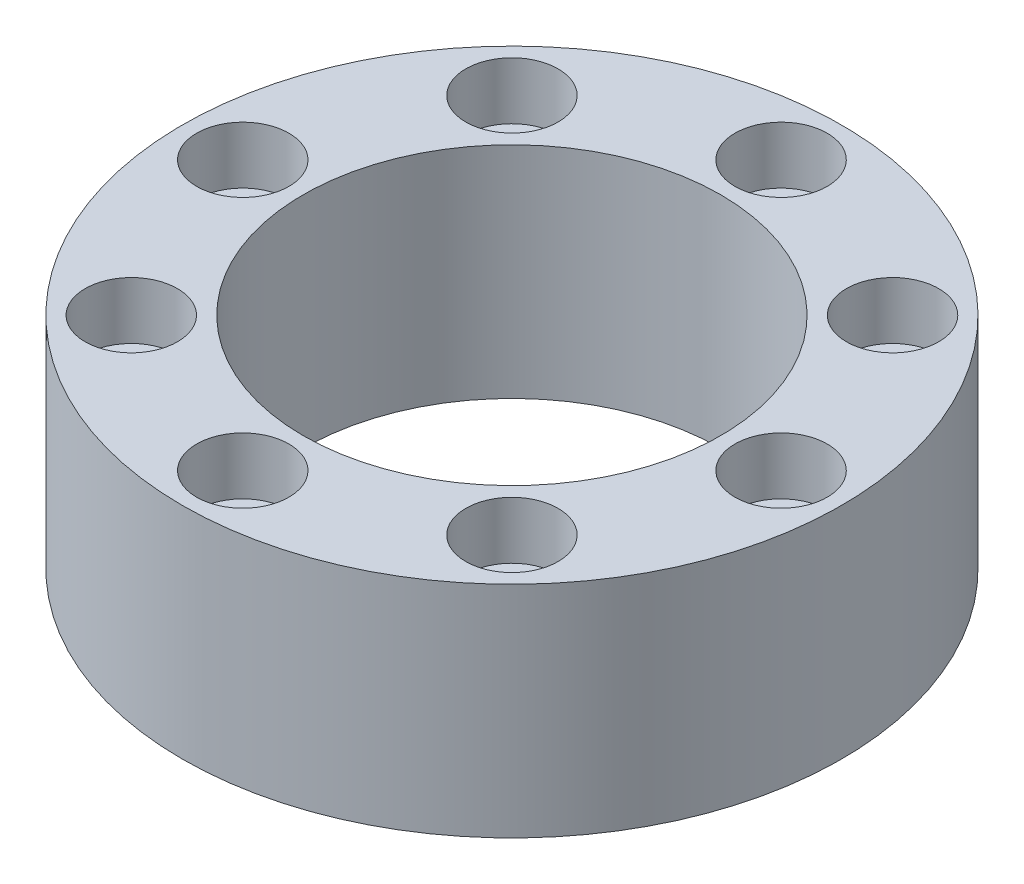
from build123d import *

# Parameters (mm, degrees)
ESQUISSE1_R             = 30
ESQUISSE1_R_2           = 19
BOSS_EXTRU_2_DEPTH      = 20
ESQUISSE5_R             = 2.55
ENL_V_MAT_EXTRU_3_DEPTH = 47.904157598
ESQUISSE6_R             = 4.2
ENL_V_MAT_EXTRU_4_DEPTH = 5.2


with BuildPart() as part:
    # Esquisse1 → Boss.-Extru.2 (new body)
    with BuildSketch(Plane(origin=(0, 0, 0), x_dir=(1, 0, 0), z_dir=(0, 1, 0))):
        Circle(ESQUISSE1_R)
        Circle(ESQUISSE1_R_2, mode=Mode.SUBTRACT)
    extrude(amount=BOSS_EXTRU_2_DEPTH)

    # Esquisse5 → Enlèv. mat.-Extru.3 (cut, through all)
    with BuildSketch(Plane(origin=(0, 20, 0), x_dir=(1, 0, 0), z_dir=(0, 1, 0))):
        with Locations((24.5, 0)):
            Circle(ESQUISSE5_R)
        with Locations((17.324116139, -17.324116139)):
            Circle(ESQUISSE5_R)
        with Locations((0, -24.5)):
            Circle(ESQUISSE5_R)
        with Locations((-17.324116139, -17.324116139)):
            Circle(ESQUISSE5_R)
        with Locations((-24.5, 0)):
            Circle(ESQUISSE5_R)
        with Locations((-17.324116139, 17.324116139)):
            Circle(ESQUISSE5_R)
        with Locations((0, 24.5)):
            Circle(ESQUISSE5_R)
        with Locations((17.324116139, 17.324116139)):
            Circle(ESQUISSE5_R)
    extrude(amount=-ENL_V_MAT_EXTRU_3_DEPTH, mode=Mode.SUBTRACT)

    # Esquisse6 → Enlèv. mat.-Extru.4 (cut)
    with BuildSketch(Plane(origin=(0, 20, 0), x_dir=(1, 0, 0), z_dir=(0, 1, 0))):
        with Locations((24.5, 0)):
            Circle(ESQUISSE6_R)
        with Locations((17.324116139, 17.324116139)):
            Circle(ESQUISSE6_R)
        with Locations((0, 24.5)):
            Circle(ESQUISSE6_R)
        with Locations((-17.324116139, 17.324116139)):
            Circle(ESQUISSE6_R)
        with Locations((-24.5, 0)):
            Circle(ESQUISSE6_R)
        with Locations((-17.324116139, -17.324116139)):
            Circle(ESQUISSE6_R)
        with Locations((0, -24.5)):
            Circle(ESQUISSE6_R)
        with Locations((17.324116139, -17.324116139)):
            Circle(ESQUISSE6_R)
    extrude(amount=-ENL_V_MAT_EXTRU_4_DEPTH, mode=Mode.SUBTRACT)


solid = part.part
